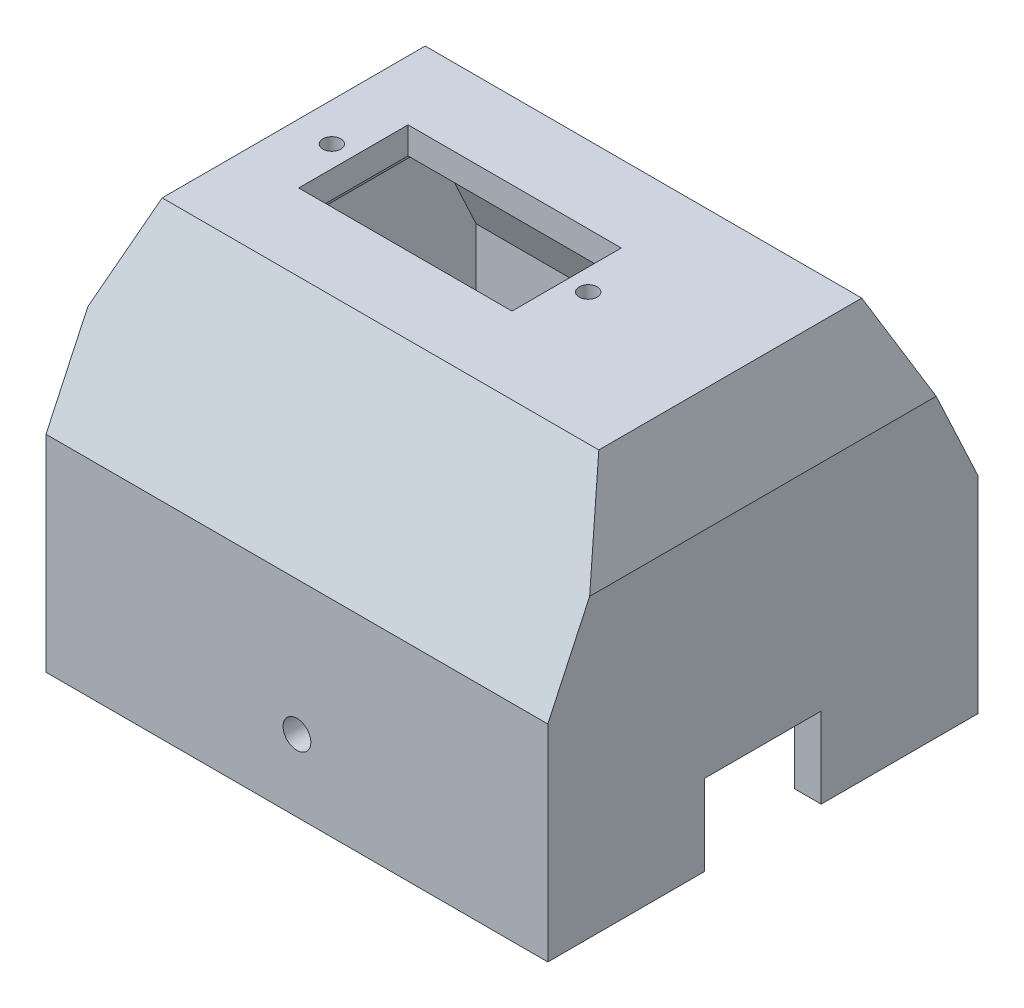
from build123d import *
from OCP.BRepFilletAPI import BRepFilletAPI_MakeChamfer

# Parameters (mm, degrees)
SKETCH_47_W         = 56
SKETCH_47_H         = 48
EXTRUDE_4_DEPTH     = 43
CHAMFER_1_SIZE      = 10
CHAMFER_1_SIZE2     = 3.639702343
CHAMFER_2_SIZE      = 20
CHAMFER_2_SIZE2     = 9.326153163
SHELL_1_T           = -3
CUT_EXTRUDE_3_REACH = 86.392
SKETCH_48_R         = 1
SKETCH_48_W         = 23.8
SKETCH_48_H         = 12.2
SKETCH_49_R         = 1.55
CUT_EXTRUDE_4_DEPTH = 71.263788682
CUT_EXTRUDE_5_REACH = 76.572
SKETCH_50_W         = 13
SKETCH_50_H         = 9
CUT_EXTRUDE_6_REACH = 76.572
SKETCH_51_W         = 10.719183514
SKETCH_51_H         = 21.879791556


with BuildPart() as part:
    # 草图47 → 凸台-拉伸4 (new body)
    with BuildSketch(Plane(origin=(0, 0, 0), x_dir=(1, 0, 0), z_dir=(0, 1, 0))):
        Rectangle(SKETCH_47_W, SKETCH_47_H)
    extrude(amount=EXTRUDE_4_DEPTH)

    # 倒角1: one chamfer whose edges measure the first distance from different faces: ONE call of the kernel's chamfer builder (chamfer() names one face for all edges)
    chamfer_1_edges_1 = [part.edges().sort_by_distance(p)[0] for p in [
        (28, 43, 0),
    ]]
    chamfer_1_side_1 = [part.faces().sort_by_distance(p)[0] for p in [
        (28, 21.5, 0),
    ]]
    chamfer_1_edges_2 = [part.edges().sort_by_distance(p)[0] for p in [
        (-28, 43, 0),
    ]]
    chamfer_1_side_2 = [part.faces().sort_by_distance(p)[0] for p in [
        (-28, 21.5, 0),
    ]]
    chamfer_1 = BRepFilletAPI_MakeChamfer(part.part.solid().wrapped)
    for e in chamfer_1_edges_1:
        chamfer_1.Add(CHAMFER_1_SIZE, CHAMFER_1_SIZE2, e.wrapped, chamfer_1_side_1[0].wrapped)  # the first distance lies on this face
    for e in chamfer_1_edges_2:
        chamfer_1.Add(CHAMFER_1_SIZE, CHAMFER_1_SIZE2, e.wrapped, chamfer_1_side_2[0].wrapped)  # the first distance lies on this face
    add(Compound.cast(chamfer_1.Shape()), mode=Mode.REPLACE)

    # 倒角2: one chamfer whose edges measure the first distance from different faces: ONE call of the kernel's chamfer builder (chamfer() names one face for all edges)
    chamfer_2_edges_1 = [part.edges().sort_by_distance(p)[0] for p in [
        (0, 43, -24),
    ]]
    chamfer_2_side_1 = [part.faces().sort_by_distance(p)[0] for p in [
        (0, 21.221195917, -24),
    ]]
    chamfer_2_edges_2 = [part.edges().sort_by_distance(p)[0] for p in [
        (0, 43, 24),
    ]]
    chamfer_2_side_2 = [part.faces().sort_by_distance(p)[0] for p in [
        (0, 21.221195917, 24),
    ]]
    chamfer_2 = BRepFilletAPI_MakeChamfer(part.part.solid().wrapped)
    for e in chamfer_2_edges_1:
        chamfer_2.Add(CHAMFER_2_SIZE, CHAMFER_2_SIZE2, e.wrapped, chamfer_2_side_1[0].wrapped)  # the first distance lies on this face
    for e in chamfer_2_edges_2:
        chamfer_2.Add(CHAMFER_2_SIZE, CHAMFER_2_SIZE2, e.wrapped, chamfer_2_side_2[0].wrapped)  # the first distance lies on this face
    add(Compound.cast(chamfer_2.Shape()), mode=Mode.REPLACE)

    # 抽壳1
    shell_1_openings = [part.faces().sort_by_distance(p)[0] for p in [
        (0, 0, 0),
    ]]
    offset(amount=SHELL_1_T, openings=shell_1_openings, kind=Kind.INTERSECTION)

    # 草图48 → 切除-拉伸3 (cut, up to next)
    with BuildSketch(Plane(origin=(0, 43, -43), x_dir=(1, 0, 0), z_dir=(0, -1, 0)), mode=Mode.PRIVATE) as cut_extrude_3_sk1:
        with Locations((-20.1, 43)):
            Circle(SKETCH_48_R)
    cut_extrude_3_tool1 = extrude(cut_extrude_3_sk1.sketch, amount=CUT_EXTRUDE_3_REACH, mode=Mode.PRIVATE) & part.part
    # 草图48 → 切除-拉伸3 (cut, up to next)
    with BuildSketch(Plane(origin=(0, 43, -43), x_dir=(1, 0, 0), z_dir=(0, -1, 0)), mode=Mode.PRIVATE) as cut_extrude_3_sk2:
        with Locations((8.5, 43)):
            Circle(SKETCH_48_R)
    cut_extrude_3_tool2 = extrude(cut_extrude_3_sk2.sketch, amount=CUT_EXTRUDE_3_REACH, mode=Mode.PRIVATE) & part.part
    # 草图48 → 切除-拉伸3 (cut, up to next)
    with BuildSketch(Plane(origin=(0, 43, -43), x_dir=(1, 0, 0), z_dir=(0, -1, 0)), mode=Mode.PRIVATE) as cut_extrude_3_sk3:
        with Locations((-5.8, 43)):
            Rectangle(SKETCH_48_W, SKETCH_48_H)
    cut_extrude_3_tool3 = extrude(cut_extrude_3_sk3.sketch, amount=CUT_EXTRUDE_3_REACH, mode=Mode.PRIVATE) & part.part
    add(cut_extrude_3_tool1.solids().sort_by_distance((-20.1, 43, 0))[0], mode=Mode.SUBTRACT)
    add(cut_extrude_3_tool2.solids().sort_by_distance((8.5, 43, 0))[0], mode=Mode.SUBTRACT)
    add(cut_extrude_3_tool3.solids().sort_by_distance((-5.8, 43, 0))[0], mode=Mode.SUBTRACT)

    # 草图49 → 切除-拉伸4 (cut, through all)
    with BuildSketch(Plane(origin=(0, 0, -24), x_dir=(-1, 0, 0), z_dir=(0, 0, -1))):
        with Locations((0, 8)):
            Circle(SKETCH_49_R)
    extrude(amount=-CUT_EXTRUDE_4_DEPTH, mode=Mode.SUBTRACT)

    # 草图50 → 切除-拉伸5 (cut, up to next)
    with BuildSketch(Plane(origin=(28, 0, 0), x_dir=(0, 0, -1), z_dir=(1, 0, 0)), mode=Mode.PRIVATE) as cut_extrude_5_sk1:
        with Locations((0, 4.5)):
            Rectangle(SKETCH_50_W, SKETCH_50_H)
    cut_extrude_5_tool1 = extrude(cut_extrude_5_sk1.sketch, amount=-CUT_EXTRUDE_5_REACH, mode=Mode.PRIVATE) & part.part
    add(cut_extrude_5_tool1.solids().sort_by_distance((28, 4.5, 0))[0], mode=Mode.SUBTRACT)

    # 草图51 → 切除-拉伸6 (cut, up to next)
    with BuildSketch(Plane.ZY.offset(28), mode=Mode.PRIVATE) as cut_extrude_6_sk1:
        with Locations((0, 10.939895778)):
            Rectangle(SKETCH_51_W, SKETCH_51_H)
    cut_extrude_6_tool1 = extrude(cut_extrude_6_sk1.sketch, amount=-CUT_EXTRUDE_6_REACH, mode=Mode.PRIVATE) & part.part
    add(cut_extrude_6_tool1.solids().sort_by_distance((-28, 10.939896, 0))[0], mode=Mode.SUBTRACT)


solid = part.part
